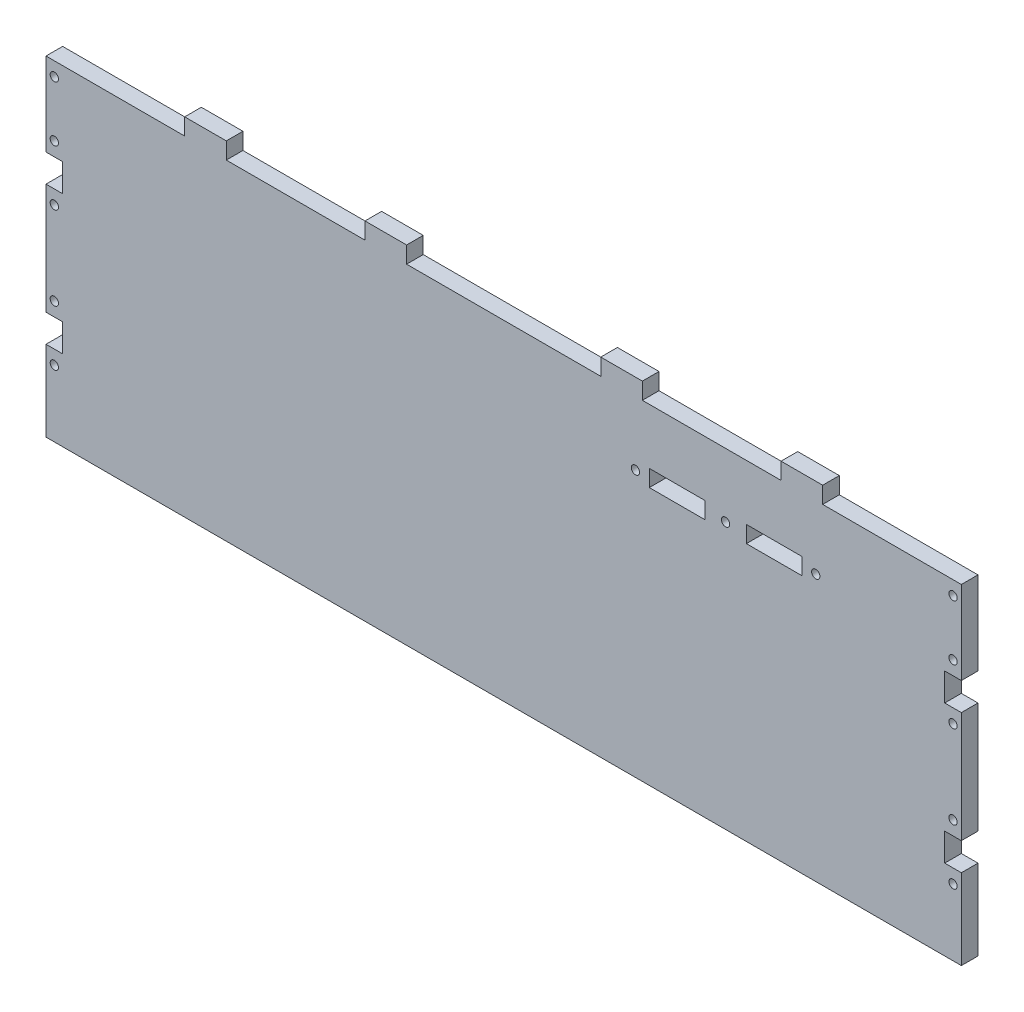
from build123d import *

# Parameters (mm, degrees)
ESQUISSE1_W             = 330
ESQUISSE1_H             = 238
ESQUISSE1_W_2           = 15
ESQUISSE1_H_2           = 6
ESQUISSE1_W_3           = 20
BOSS_EXTRU_1_DEPTH      = 6
ESQUISSE2_W             = 15
ESQUISSE2_H             = 6
BOSS_EXTRU_2_DEPTH      = 6
ESQUISSE3_W             = 6
ESQUISSE3_H             = 10
ESQUISSE3_W_2           = 12
ENL_V_MAT_EXTRU_1_DEPTH = 6
ESQUISSE4_R             = 1.5
ENL_V_MAT_EXTRU_2_DEPTH = 6
ESQUISSE5_W             = 423.604058921
ESQUISSE5_H             = 150.356061945
ENL_V_MAT_EXTRU_3_DEPTH = 6


with BuildPart() as part:
    # Esquisse1 → Boss.-Extru.1 (new body)
    with BuildSketch(Plane.XY):
        Rectangle(ESQUISSE1_W, ESQUISSE1_H)
        with Locations((-85, -58)):
            Rectangle(ESQUISSE1_W_2, ESQUISSE1_H_2, mode=Mode.SUBTRACT)
        with Locations((0, -58)):
            Rectangle(ESQUISSE1_W_2, ESQUISSE1_H_2, mode=Mode.SUBTRACT)
        with Locations((85, -58)):
            Rectangle(ESQUISSE1_W_2, ESQUISSE1_H_2, mode=Mode.SUBTRACT)
        with Locations((62.5, 96)):
            Rectangle(ESQUISSE1_W_3, ESQUISSE1_H_2, mode=Mode.SUBTRACT)
        with Locations((97.5, 96)):
            Rectangle(ESQUISSE1_W_3, ESQUISSE1_H_2, mode=Mode.SUBTRACT)
    extrude(amount=BOSS_EXTRU_1_DEPTH)

    # Esquisse2 → Boss.-Extru.2 (add)
    with BuildSketch(Plane.XY.offset(6)):
        with Locations((-107.5, 122)):
            Rectangle(ESQUISSE2_W, ESQUISSE2_H)
        with Locations((107.5, 122)):
            Rectangle(ESQUISSE2_W, ESQUISSE2_H)
        with Locations((42.5, 122)):
            Rectangle(ESQUISSE2_W, ESQUISSE2_H)
        with Locations((-42.5, 122)):
            Rectangle(ESQUISSE2_W, ESQUISSE2_H)
        with Locations((107.5, -122)):
            Rectangle(ESQUISSE2_W, ESQUISSE2_H)
        with Locations((-107.5, -122)):
            Rectangle(ESQUISSE2_W, ESQUISSE2_H)
        with Locations((-42.5, -122)):
            Rectangle(ESQUISSE2_W, ESQUISSE2_H)
        with Locations((42.5, -122)):
            Rectangle(ESQUISSE2_W, ESQUISSE2_H)
    extrude(amount=-BOSS_EXTRU_2_DEPTH)

    # Esquisse3 → Enlèv. mat.-Extru.1 (cut)
    with BuildSketch(Plane.XY.offset(6)):
        with Locations((-162, 84)):
            Rectangle(ESQUISSE3_W, ESQUISSE3_H)
        with Locations((-162, 34)):
            Rectangle(ESQUISSE3_W, ESQUISSE3_H)
        with Locations((-162, -34)):
            Rectangle(ESQUISSE3_W, ESQUISSE3_H)
        with Locations((-162, -84)):
            Rectangle(ESQUISSE3_W, ESQUISSE3_H)
        with Locations((162, -84)):
            Rectangle(ESQUISSE3_W, ESQUISSE3_H)
        with Locations((162, -34)):
            Rectangle(ESQUISSE3_W, ESQUISSE3_H)
        with Locations((162, 34)):
            Rectangle(ESQUISSE3_W, ESQUISSE3_H)
        with Locations((162, 84)):
            Rectangle(ESQUISSE3_W, ESQUISSE3_H)
        with Locations((159, -114)):
            Rectangle(ESQUISSE3_W_2, ESQUISSE3_H)
        with Locations((-159, -114)):
            Rectangle(ESQUISSE3_W_2, ESQUISSE3_H)
    extrude(amount=-ENL_V_MAT_EXTRU_1_DEPTH, mode=Mode.SUBTRACT)

    # Esquisse4 → Enlèv. mat.-Extru.2 (cut)
    with BuildSketch(Plane.XY.offset(6)):
        with Locations((-162, 114)):
            Circle(ESQUISSE4_R)
        with Locations((-162, 94)):
            Circle(ESQUISSE4_R)
        with Locations((-162, 74)):
            Circle(ESQUISSE4_R)
        with Locations((-162, 44)):
            Circle(ESQUISSE4_R)
        with Locations((-162, 24)):
            Circle(ESQUISSE4_R)
        with Locations((47.5, 96)):
            Circle(ESQUISSE4_R)
        with Locations((-162, -24)):
            Circle(ESQUISSE4_R)
        with Locations((-162, -44)):
            Circle(ESQUISSE4_R)
        with Locations((-162, -74)):
            Circle(ESQUISSE4_R)
        with Locations((-162, -94)):
            Circle(ESQUISSE4_R)
        with Locations((-97.5, -58)):
            Circle(ESQUISSE4_R)
        with Locations((-72.5, -58)):
            Circle(ESQUISSE4_R)
        with Locations((162, -94)):
            Circle(ESQUISSE4_R)
        with Locations((162, -74)):
            Circle(ESQUISSE4_R)
        with Locations((162, -44)):
            Circle(ESQUISSE4_R)
        with Locations((162, -24)):
            Circle(ESQUISSE4_R)
        with Locations((80, 96)):
            Circle(ESQUISSE4_R)
        with Locations((162, 24)):
            Circle(ESQUISSE4_R)
        with Locations((162, 44)):
            Circle(ESQUISSE4_R)
        with Locations((162, 74)):
            Circle(ESQUISSE4_R)
        with Locations((162, 94)):
            Circle(ESQUISSE4_R)
        with Locations((162, 114)):
            Circle(ESQUISSE4_R)
        with Locations((-12.5, -58)):
            Circle(ESQUISSE4_R)
        with Locations((12.5, -58)):
            Circle(ESQUISSE4_R)
        with Locations((72.5, -58)):
            Circle(ESQUISSE4_R)
        with Locations((97.5, -58)):
            Circle(ESQUISSE4_R)
        with Locations((112.5, 96)):
            Circle(ESQUISSE4_R)
    extrude(amount=-ENL_V_MAT_EXTRU_2_DEPTH, mode=Mode.SUBTRACT)

    # Esquisse5 → Enlèv. mat.-Extru.3 (cut)
    with BuildSketch(Plane.XY.offset(6)):
        with Locations((11.705214191, -75.178030973)):
            Rectangle(ESQUISSE5_W, ESQUISSE5_H)
    extrude(amount=-ENL_V_MAT_EXTRU_3_DEPTH, mode=Mode.SUBTRACT)


solid = part.part
